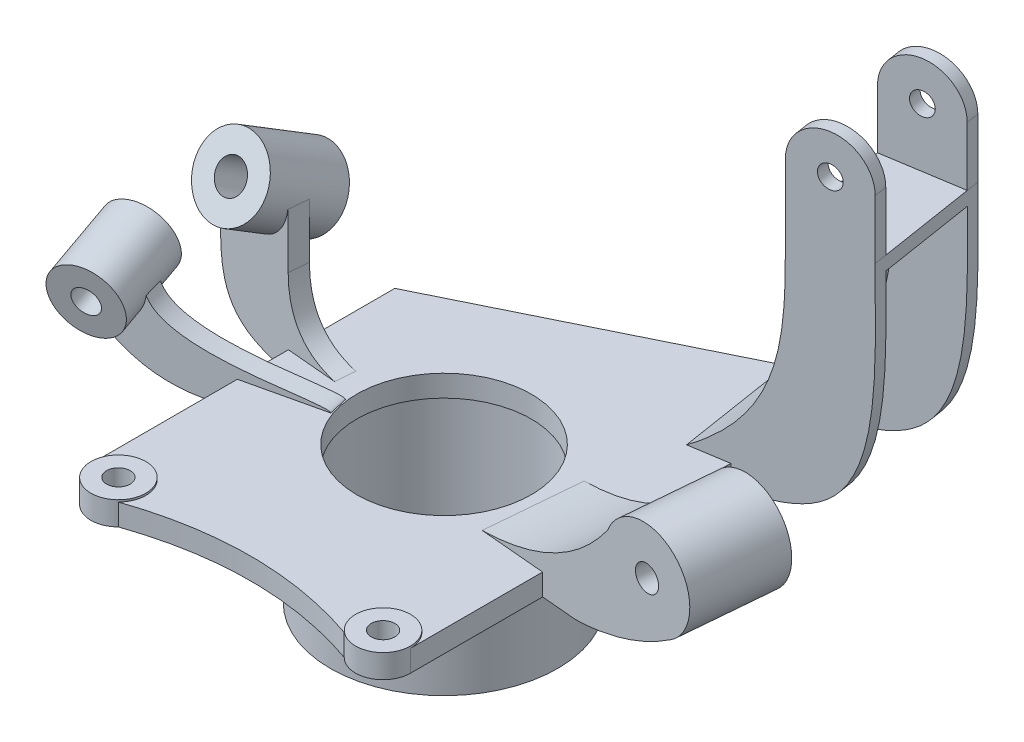
from build123d import *

# Parameters (mm, degrees)
SKETCH_1_R               = 6
SKETCH_1_R_2             = 44.5
EXTRUDE_1_DEPTH          = 11
EXTRUDE_START            = 1
SKETCH_1_3_R             = 14
SKETCH_1_3_R_2           = 6
EXTRUDE_2_DEPTH          = 1
SKETCH_2_R               = 63
SKETCH_2_R_2             = 48
EXTRUDE_3_DEPTH          = 17
SKETCH_4_R               = 58
SKETCH_4_R_2             = 48
EXTRUDE_4_DEPTH          = 42
EXTRUDE_5_DEPTH          = 24
EXTRUDE_5_DEPTH_BACK     = 24
SKETCH_6_R               = 6.5
EXTRUDE_6_DEPTH          = 31.5
EXTRUDE_6_DEPTH_BACK     = 31.5
SKETCH_9_R               = 5.75
CUT_EXTRUDE_1_DEPTH      = 25
CUT_EXTRUDE_1_DEPTH_BACK = 25
SKETCH_9_4_R             = 5.75
EXTRUDE_START_2          = -63
EXTRUDE_9_DEPTH          = 63
EXTRUDE_START_3          = -6.5
EXTRUDE_10_DEPTH         = 6.5
EXTRUDE_11_DEPTH         = 19
EXTRUDE_11_DEPTH_BACK    = 19
SKETCH_21_R              = 17
SKETCH_21_R_2            = 6.5
EXTRUDE_25_DEPTH         = 5
EXTRUDE_25_DEPTH_BACK    = 5
EXTRUDE_26_DEPTH         = 24.5
EXTRUDE_26_DEPTH_BACK    = 18.5
SKETCH_29_R              = 19
SKETCH_29_R_2            = 8
EXTRUDE_28_DEPTH         = 5
EXTRUDE_28_DEPTH_BACK    = 5
SKETCH_36_R              = 17
SKETCH_36_R_2            = 6.5
CUT_EXTRUDE_3_DEPTH      = 93
EXTRUDE_30_DEPTH         = 19
EXTRUDE_30_DEPTH_BACK    = 19
SKETCH_21_4_R            = 17
SKETCH_21_4_R_2          = 6.5
SKETCH_31_R              = 19
SKETCH_31_R_2            = 8
CUT_EXTRUDE_5_DEPTH      = 166
EXTRUDE_31_DEPTH         = 24.5
EXTRUDE_31_DEPTH_BACK    = 18.5
SKETCH_29_2_R            = 19
SKETCH_29_2_R_2          = 8


# Read off the part's stored shape, not the designer's step: 凸台-拉伸9, 凸台-拉伸10
with BuildPart() as part:
    # 草图1 → 凸台-拉伸1 (new body)
    with BuildSketch(Plane(origin=(0, 0, 0), x_dir=(1, 0, 0), z_dir=(0, 1, 0))):
        with BuildLine():
            ThreePointArc((-81.5, -98.610344285), (-72.857568053, -111.54465774), (-57.600505063, -108.509839222))
            add(Edge.make_bspline(
                [(-57.600505063, -108.509839222), (-28.800252532, -98.610344285), (0, -98.610344285)],
                knots=[0, 0, 0, 0.5, 0.5, 0.5], degree=2))
            add(Edge.make_bspline(
                [(0, -98.610344285), (28.800252532, -98.610344285), (57.600505063, -108.509839222)],
                knots=[0.5, 0.5, 0.5, 1, 1, 1], degree=2))
            ThreePointArc((57.600505063, -108.509839222), (72.857568053, -111.54465774), (81.5, -98.610344285))
            Line((81.5, -98.610344285), (81.5, 136.38965572))
            Line((81.5, 136.38965572), (-81.5, 56.38965572))
            Line((-81.5, 56.38965572), (-81.5, -98.610344285))
        make_face()
        with Locations(Location((-67.5, -98.610344285, 0), (0, 0, 270))):
            Circle(SKETCH_1_R, mode=Mode.SUBTRACT)
        with Locations(Location((0, 0, 0), (0, 0, 270))):
            Circle(SKETCH_1_R_2, mode=Mode.SUBTRACT)
        with Locations(Location((67.5, -98.610344285, 0), (0, 0, 270))):
            Circle(SKETCH_1_R, mode=Mode.SUBTRACT)
    extrude(amount=-EXTRUDE_1_DEPTH)

    # 草图1<3> → 凸台-拉伸2 (add)
    # profile 1 of 2: a face of its own
    with BuildSketch(Plane(origin=(0, 0, 0), x_dir=(1, 0, 0), z_dir=(0, 1, 0)).offset(EXTRUDE_START)):
        with Locations(Location((-67.5, -98.610344285, 0), (0, 0, 270))):
            Circle(SKETCH_1_3_R)
        with Locations(Location((-67.5, -98.610344285, 0), (0, 0, 270))):
            Circle(SKETCH_1_3_R_2, mode=Mode.SUBTRACT)
    # profile 2 of 2: a face of its own
    with BuildSketch(Plane(origin=(0, 0, 0), x_dir=(1, 0, 0), z_dir=(0, 1, 0)).offset(EXTRUDE_START)):
        with Locations(Location((67.5, -98.610344285, 0), (0, 0, 270))):
            Circle(SKETCH_1_3_R)
        with Locations(Location((67.5, -98.610344285, 0), (0, 0, 270))):
            Circle(SKETCH_1_3_R_2, mode=Mode.SUBTRACT)
    extrude(amount=-EXTRUDE_2_DEPTH)

    # 草图2 → 凸台-拉伸3 (add)
    with BuildSketch(Plane.XZ.offset(11)):
        with Locations(Location((0, 0, 0), (0, 0, 90))):
            Circle(SKETCH_2_R)
        with Locations(Location((0, 0, 0), (0, 0, 270))):
            Circle(SKETCH_2_R_2, mode=Mode.SUBTRACT)
    extrude(amount=EXTRUDE_3_DEPTH)

    # 草图4 → 凸台-拉伸4 (add)
    with BuildSketch(Plane.XZ.offset(28)):
        with Locations(Location((0, 0, 0), (0, 0, 90))):
            Circle(SKETCH_4_R)
        with Locations(Location((0, 0, 0), (0, 0, 270))):
            Circle(SKETCH_4_R_2, mode=Mode.SUBTRACT)
    extrude(amount=EXTRUDE_4_DEPTH)

    # 草图6 → 凸台-拉伸5 (add, two sides: drawn at the far end of the back side and taken through both)
    with BuildSketch(Plane(origin=(0, 0, 0), x_dir=(0.9961946980917444, 0, 0.08715574274767217), z_dir=(-0.08715574274767217, 0, 0.9961946980917444)).offset(-EXTRUDE_5_DEPTH_BACK)):
        with BuildLine():
            add(Edge.make_bspline(
                [(120.29297728, 38.102095468), (95.512323378, 4.747553828), (50, 0)],
                knots=[0, 0, 0, 1, 1, 1], degree=2))
            Line((50, 0), (72.836132883, -11))
            Line((72.836132883, -11), (102.570189868, -11))
            add(Edge.make_bspline(
                [(102.570189868, -11), (131.599183667, -7.700204363), (155.788038807, 9.014304499)],
                knots=[0.206192363, 0.206192363, 0.206192363, 0.87644864, 0.87644864, 0.87644864], degree=2))
            ThreePointArc((155.788038807, 9.014304499), (157.71223075, 47.5630826), (120.29297728, 38.102095468))
        make_face()
        with Locations((142.5, 29)):
            Circle(SKETCH_6_R, mode=Mode.SUBTRACT)
    extrude(amount=EXTRUDE_5_DEPTH + EXTRUDE_5_DEPTH_BACK)



with BuildPart() as body_2:
    # 草图9 → 凸台-拉伸6 (new, two sides: drawn at the far end of the back side and taken through both)
    with BuildSketch(Plane(origin=(-12.939074454, 0, -81.694100932), x_dir=(0.9876883405951375, 0, -0.1564344650402319), z_dir=(0.1564344650402319, 0, 0.9876883405951375)).offset(-EXTRUDE_6_DEPTH_BACK)):
        with BuildLine():
            Line((135, 115), (155, 115))
            Line((155, 115), (155, 145))
            ThreePointArc((155, 145), (135, 165), (115, 145))
            Line((115, 145), (115, 115))
            Line((115, 115), (135, 115))
        make_face()
        with Locations((135, 145)):
            Circle(SKETCH_9_R, mode=Mode.SUBTRACT)
    extrude(amount=EXTRUDE_6_DEPTH + EXTRUDE_6_DEPTH_BACK)

    # 草图9<4> → 切除-拉伸1 (cut, two sides: drawn at the far end of the back side and taken through both)
    with BuildSketch(Plane(origin=(-12.939074454, 0, -81.694100932), x_dir=(0.9876883405951375, 0, -0.1564344650402319), z_dir=(0.1564344650402319, 0, 0.9876883405951375)).offset(-CUT_EXTRUDE_1_DEPTH_BACK)):
        with BuildLine():
            Line((135, 115), (155, 115))
            Line((155, 115), (155, 145))
            ThreePointArc((155, 145), (135, 165), (115, 145))
            Line((115, 145), (115, 115))
            Line((115, 115), (135, 115))
        make_face()
        with Locations((135, 145)):
            Circle(SKETCH_9_4_R, mode=Mode.SUBTRACT)
    extrude(amount=CUT_EXTRUDE_1_DEPTH + CUT_EXTRUDE_1_DEPTH_BACK, mode=Mode.SUBTRACT)


with BuildPart() as cut_extrude_1_piece_1:
    # of the separate pieces the step leaves, piece 1, a body of its own (cut_extrude_1_pieces)
    add(body_2.part.solids().sort_by_distance((105.572770363, 145, -68.571881683))[0])


with BuildPart() as cut_extrude_1_piece_2:
    # of the separate pieces the step leaves, piece 2, a body of its own (cut_extrude_1_pieces)
    add(body_2.part.solids().sort_by_distance((96.734223088, 145, -124.376272927))[0])


with BuildPart() as part_1:
    add(part.part)

    add(cut_extrude_1_piece_1.part)  # 凸台-拉伸9 merges 切除-拉伸1 piece 1
    # 凸台-拉伸9 outline → 凸台-拉伸9 (add)
    with BuildSketch(Plane(origin=(-8.011388805, 0, -50.581918203), x_dir=(0.9876883405951375, 0, -0.1564344650402319), z_dir=(0.1564344650402319, 0, 0.9876883405951375)).offset(EXTRUDE_START_2)):
        with BuildLine():
            add(Edge.make_bspline(
                [(122.004661708, 108), (122.004887122, 107.471502612), (122.00542966, 104.105793503), (121.990189198, 97.961448333), (121.8592962, 89.673204063), (121.438584588, 78.796103086), (120.260266546, 65.504234316), (117.155745547, 49.989631318), (112.597591225, 37.453126602), (107.464429745, 27.734667088), (102.809832242, 20.624809869), (97.294880725, 13.712100534), (91.940383893, 8.124686346), (87.17581549, 3.758793697), (84.412504832, 1.427469519), (82.863597307, 0.18122902), (82.636817019, 0)],
                knots=[0.050883673, 0.050883673, 0.050883673, 0.050883673, 0.0625, 0.125, 0.1875, 0.25, 0.375, 0.5, 0.625, 0.6875, 0.75, 0.8125, 0.875, 0.90625, 0.9375, 0.942825958, 0.942825958, 0.942825958, 0.942825958], degree=3))
            Line((122.004661708, 108), (155.021691408, 108))
            add(Edge.make_bspline(
                [(155, 115), (155, 112.682400521), (155.008775962, 110.347251976), (155.021691408, 108)],
                knots=[0, 0, 0, 0, 0.036430488, 0.036430488, 0.036430488, 0.036430488], degree=3))
            Line((155, 115), (115, 115))
            add(Edge.make_bspline(
                [(115, 115), (115, 112.642930219), (115.003675151, 110.30975903), (115.004661903, 108)],
                knots=[0, 0, 0, 0, 0.05086728, 0.05086728, 0.05086728, 0.05086728], degree=3))
            add(Edge.make_bspline(
                [(115.004661903, 108), (115.023073706, 64.902199389), (114.105496752, 29.955538284), (70.912473246, 0)],
                knots=[0.05086728, 0.05086728, 0.05086728, 0.05086728, 1, 1, 1, 1], degree=3))
            Line((70.912473246, 0), (82.636817019, 0))
        make_face()
        with BuildLine():
            add(Edge.make_bspline(
                [(82.636817019, 0), (81.532966511, -0.882130223), (79.716781868, -2.286804359), (77.699571647, -3.768331055), (76.841650808, -4.384168945), (76.710367529, -4.478084651)],
                knots=[0.942825958, 0.942825958, 0.942825958, 0.942825958, 0.96875, 0.984375, 0.987188577, 0.987188577, 0.987188577, 0.987188577], degree=3))
            Line((82.636817019, 0), (70.912473246, 0))
            Line((70.912473246, 0), (74.901683817, -5.752060415))
            add(Edge.make_bspline(
                [(76.710367529, -4.478084651), (76.11257846, -4.905723135), (75.507086214, -5.332197363), (74.901683817, -5.752060415)],
                knots=[0.987188577, 0.987188577, 0.987188577, 0.987188577, 1, 1, 1, 1], degree=3))
        make_face()
    extrude(amount=EXTRUDE_9_DEPTH)

    # 凸台-拉伸10 outline → 凸台-拉伸10 (add)
    with BuildSketch(Plane(origin=(-8.011388805, 0, -50.581918203), x_dir=(0.9876883405951375, 0, -0.1564344650402319), z_dir=(0.1564344650402319, 0, 0.9876883405951375)).offset(EXTRUDE_START_3)):
        with BuildLine():
            Line((155.021691408, 108), (122.004661708, 108))
            add(Edge.make_bspline(
                [(122.004661708, 108), (122.004887122, 107.471502612), (122.00542966, 104.105793503), (121.990189198, 97.961448333), (121.8592962, 89.673204063), (121.438584588, 78.796103086), (120.260266546, 65.504234316), (117.155745547, 49.989631318), (112.597591225, 37.453126602), (107.464429745, 27.734667088), (102.809832242, 20.624809869), (97.294880725, 13.712100534), (91.940383893, 8.124686346), (87.17581549, 3.758793697), (83.356328364, 0.536404401), (79.958958222, -2.108939538), (77.117024133, -4.196179221), (75.640041492, -5.239989256), (74.901683817, -5.752060415)],
                knots=[0.050883673, 0.050883673, 0.050883673, 0.050883673, 0.0625, 0.125, 0.1875, 0.25, 0.375, 0.5, 0.625, 0.6875, 0.75, 0.8125, 0.875, 0.90625, 0.9375, 0.96875, 0.984375, 1, 1, 1, 1], degree=3))
            Line((74.901683817, -5.752060415), (70.912473246, 0))
            Line((70.912473246, 0), (78.476053186, -11))
            add(Edge.make_bspline(
                [(78.476053186, -11), (108.653112753, -11), (157.393303211, 1.678771032), (155.235889092, 69.071732187), (155.021691408, 108)],
                knots=[0.94893448, 0.94893448, 0.94893448, 0.94893448, 1.308318411, 1.912503992, 1.912503992, 1.912503992, 1.912503992], degree=3))
        make_face()
    extrude_10 = extrude(amount=EXTRUDE_10_DEPTH)

    # 镜向4: 凸台-拉伸10 across plane
    add(extrude_10.mirror(Plane(origin=(-12.939074454, 0, -81.694100932), x_dir=(0.9876883405951375, 0, -0.1564344650402319), z_dir=(0.1564344650402319, 0, 0.9876883405951375))))



with BuildPart() as body_3:
    # 草图21 → 凸台-拉伸11 (new, two sides: drawn at the far end of the back side and taken through both)
    with BuildSketch(Plane(origin=(-0.961722398, 0.75384224, -4.165677365), x_dir=(0.9743700647852335, 0, -0.2249510543438726), z_dir=(-0.22153354236611628, 0.17364817766693072, -0.9595671941035053)).offset(-EXTRUDE_11_DEPTH_BACK)):
        with Locations(Location((-140.5, -24.620193825, 0), (0, 0, 180))):
            Circle(SKETCH_21_R)
        with Locations(Location((-140.5, -24.620193825, 0), (0, 0, 180))):
            Circle(SKETCH_21_R_2, mode=Mode.SUBTRACT)
    extrude(amount=EXTRUDE_11_DEPTH + EXTRUDE_11_DEPTH_BACK)


with BuildPart() as part_2:
    add(part_1.part)

    add(body_3.part)  # 凸台-拉伸25 merges body 3
    # 草图26 → 凸台-拉伸25 (add, two sides: drawn at the far end of the back side and taken through both)
    with BuildSketch(Plane(origin=(0, 0, 0), x_dir=(-0.9743700647852335, 0, 0.2249510543438726), z_dir=(-0.2249510543438726, 0, -0.9743700647852335)).offset(-EXTRUDE_25_DEPTH_BACK)):
        with BuildLine():
            add(Edge.make_bspline(
                [(124.568363257, 26.4774812), (122.134615907, 0.234454412), (47.236797124, 4.480774504), (45, 0)],
                knots=[0, 0, 0, 0, 1, 1, 1, 1], degree=3))
            Line((45, 0), (65, -11))
            add(Edge.make_bspline(
                [(152.820836543, 14.792307466), (126.542809695, -16.92566135), (104.650964218, -16.405619405), (65, -11)],
                knots=[0, 0, 0, 0, 1, 1, 1, 1], degree=3))
            ThreePointArc((152.820836543, 14.792307466), (134.384831088, 10.214713084), (124.568363257, 26.4774812))
        make_face()
    extrude(amount=EXTRUDE_25_DEPTH + EXTRUDE_25_DEPTH_BACK)

    # 草图36 → 切除-拉伸3 (cut)
    with BuildSketch(Plane(origin=(-5.170859703, 4.053157616, -22.397454053), x_dir=(-0.9751527519351623, -0.03944909743384868, 0.2179928418662745), z_dir=(-0.2215335423661163, 0.1736481776669306, -0.9595671941035053))):
        with Locations((139.401003006, 30.228534612)):
            Circle(SKETCH_36_R)
        with Locations((139.401003006, 30.228534612)):
            Circle(SKETCH_36_R_2, mode=Mode.SUBTRACT)
    extrude(amount=-CUT_EXTRUDE_3_DEPTH, mode=Mode.SUBTRACT)


with BuildPart() as body_3_2:
    # 草图29 → 凸台-拉伸26 (new, two sides: drawn at the far end of the back side and taken through both)
    with BuildSketch(Plane(origin=(-2.339851706, 15.5, 26.744627386), x_dir=(0.9961946980917461, 0, 0.08715574274765128), z_dir=(0.07547908730516725, -0.500000000000001, -0.8627299156628209)).offset(-EXTRUDE_26_DEPTH_BACK)):
        with Locations(Location((-100.5, -53.693575035, 0), (0, 0, 267.495231278))):
            Circle(SKETCH_29_R)
        with Locations(Location((-100.5, -53.693575035, 0), (0, 0, 267.495231278))):
            Circle(SKETCH_29_R_2, mode=Mode.SUBTRACT)
    extrude(amount=EXTRUDE_26_DEPTH + EXTRUDE_26_DEPTH_BACK)

    # 草图30 → 凸台-拉伸28 (add, two sides: drawn at the far end of the back side and taken through both)
    with BuildSketch(Plane(origin=(0, 0, 0), x_dir=(-0.9961946980917462, 0, -0.08715574274765128), z_dir=(0.08715574274765128, 0, -0.9961946980917462)).offset(-EXTRUDE_28_DEPTH_BACK)):
        with BuildLine():
            Line((81.5, 62), (81.5, 34))
            add(Edge.make_bspline(
                [(81.5, 34), (81.5, 17.217155299), (74.888479723, 3.506663047), (55.465920485, 0)],
                knots=[0, 0, 0, 0, 1, 1, 1, 1], degree=3))
            Line((55.465920485, 0), (67.911135329, -11))
            add(Edge.make_bspline(
                [(119.5, 34), (119.5, 4.223872762), (113.033309632, -10.210231267), (67.911135329, -11)],
                knots=[0, 0, 0, 0, 1, 1, 1, 1], degree=3))
            Line((119.5, 34), (119.5, 62))
            add(Edge.make_bspline(
                [(119.5, 62), (99.967607625, 34.025585831), (81.5, 62)],
                knots=[0, 0, 0, 1, 1, 1], degree=2))
        make_face()
    extrude(amount=EXTRUDE_28_DEPTH + EXTRUDE_28_DEPTH_BACK)


    add(part_2.part)  # 凸台-拉伸30 merges part
    # 草图21<4> → 凸台-拉伸30 (add, two sides: drawn at the far end of the back side and taken through both)
    with BuildSketch(Plane(origin=(-0.961722398, 0.75384224, -4.165677365), x_dir=(0.9743700647852335, 0, -0.2249510543438726), z_dir=(-0.22153354236611628, 0.17364817766693072, -0.9595671941035053)).offset(-EXTRUDE_30_DEPTH_BACK)):
        with Locations(Location((-140.5, -24.620193825, 0), (0, 0, 180))):
            Circle(SKETCH_21_4_R)
        with Locations(Location((-140.5, -24.620193825, 0), (0, 0, 180))):
            Circle(SKETCH_21_4_R_2, mode=Mode.SUBTRACT)
    extrude(amount=EXTRUDE_30_DEPTH + EXTRUDE_30_DEPTH_BACK)

    # 草图31 → 切除-拉伸5 (cut)
    with BuildSketch(Plane(origin=(-0.490614067, 3.25, 5.607744452), x_dir=(-0.9971473849835735, -0.03784750802230246, -0.06530435480825772), z_dir=(0.07547908730516727, -0.5000000000000028, -0.8627299156628199))):
        with Locations((98.057435565, 58.03438059)):
            Circle(SKETCH_31_R)
        with Locations((98.057435565, 58.03438059)):
            Circle(SKETCH_31_R_2, mode=Mode.SUBTRACT)
    extrude(amount=-CUT_EXTRUDE_5_DEPTH, mode=Mode.SUBTRACT)


with BuildPart() as cut_extrude_5_piece_1:
    # of the separate pieces the step leaves, piece 1, a body of its own (cut_extrude_5_pieces)
    add(body_3_2.part.solids().sort_by_distance((105.572770363, 145, -68.571881683))[0])



with BuildPart() as cut_extrude_5_piece_2:
    # of the separate pieces the step leaves, piece 2, a body of its own (cut_extrude_5_pieces)
    add(body_3_2.part.solids().sort_by_distance((-118.609487708, 62, -15.396084749))[0])


with BuildPart() as cut_extrude_5_piece_3:
    # of the separate pieces the step leaves, piece 3, a body of its own (cut_extrude_5_pieces)
    add(body_3_2.part.solids().sort_by_distance((-80.754089181, 62, -12.084166524))[0])


with BuildPart() as cut_extrude_5_piece_1_1:
    add(cut_extrude_5_piece_1.part)

    add(cut_extrude_5_piece_2.part)  # 凸台-拉伸31 merges 切除-拉伸5 piece 2

    add(cut_extrude_5_piece_3.part)  # 凸台-拉伸31 merges 切除-拉伸5 piece 3
    # 草图29<2> → 凸台-拉伸31 (add, two sides: drawn at the far end of the back side and taken through both)
    with BuildSketch(Plane(origin=(-2.339851706, 15.5, 26.744627386), x_dir=(0.9961946980917461, 0, 0.08715574274765128), z_dir=(0.07547908730516725, -0.500000000000001, -0.8627299156628209)).offset(-EXTRUDE_31_DEPTH_BACK)):
        with Locations(Location((-100.5, -53.693575035, 0), (0, 0, 267.495231278))):
            Circle(SKETCH_29_2_R)
        with Locations(Location((-100.5, -53.693575035, 0), (0, 0, 267.495231278))):
            Circle(SKETCH_29_2_R_2, mode=Mode.SUBTRACT)
    extrude(amount=EXTRUDE_31_DEPTH + EXTRUDE_31_DEPTH_BACK)


solid = Compound([cut_extrude_1_piece_2.part, cut_extrude_5_piece_1_1.part])
